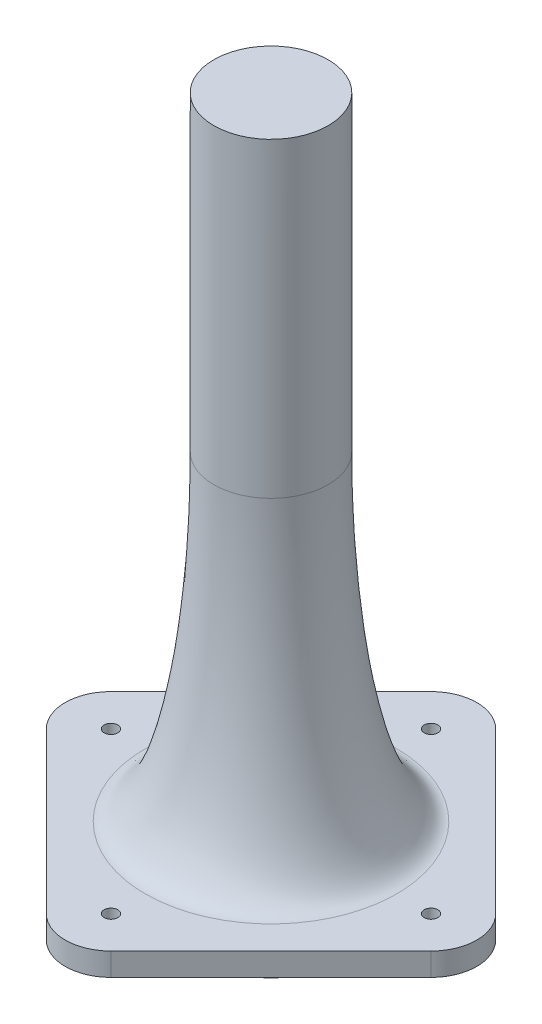
from build123d import *

# Parameters (mm, degrees)
CROQUIS1_R              = 12.5
SALIENTE_EXTRUIR1_DEPTH = 150
CROQUIS2_R              = 25
SALIENTE_EXTRUIR2_DEPTH = 7
CROQUIS3_R              = 1.5
SALIENTE_EXTRUIR3_DEPTH = 5
REDONDEO1_SIZE          = 15
REDONDEO1_SIZE_2        = 70


with BuildPart() as part:
    # Croquis1 → Saliente-Extruir1 (new body)
    with BuildSketch(Plane(origin=(0, 0, 0), x_dir=(1, 0, 0), z_dir=(0, 1, 0))):
        with Locations(Location((0, 0, 0), (0, 0, 270))):
            Circle(CROQUIS1_R)
    extrude(amount=SALIENTE_EXTRUIR1_DEPTH)

    # Croquis2 → Saliente-Extruir2 (add)
    with BuildSketch(Plane.XZ):
        with Locations(Location((0, 0, 0), (0, 0, 270))):
            Circle(CROQUIS2_R)
    extrude(amount=-SALIENTE_EXTRUIR2_DEPTH)

    # Croquis3 → Saliente-Extruir3 (add)
    with BuildSketch(Plane(origin=(0, 7, 0), x_dir=(1, 0, 0), z_dir=(0, 1, 0))):
        with BuildLine():
            Line((-7.071067812, 42.071067812), (-42.071067812, 7.071067812))
            ThreePointArc((-42.071067812, 7.071067812), (-45, 0), (-42.071067812, -7.071067812))
            Line((-42.071067812, -7.071067812), (-7.071067812, -42.071067812))
            ThreePointArc((-7.071067812, -42.071067812), (0, -45), (7.071067812, -42.071067812))
            Line((7.071067812, -42.071067812), (42.071067812, -7.071067812))
            ThreePointArc((42.071067812, -7.071067812), (45, 0), (42.071067812, 7.071067812))
            Line((42.071067812, 7.071067812), (7.071067812, 42.071067812))
            ThreePointArc((7.071067812, 42.071067812), (0, 45), (-7.071067812, 42.071067812))
        make_face()
        with Locations(Location((-35, 0, 0), (0, 0, 270))):
            Circle(CROQUIS3_R, mode=Mode.SUBTRACT)
        with Locations(Location((0, 35, 0), (0, 0, 270))):
            Circle(CROQUIS3_R, mode=Mode.SUBTRACT)
        with Locations(Location((35, 0, 0), (0, 0, 270))):
            Circle(CROQUIS3_R, mode=Mode.SUBTRACT)
        with Locations(Location((0, -35, 0), (0, 0, 270))):
            Circle(CROQUIS3_R, mode=Mode.SUBTRACT)
    extrude(amount=SALIENTE_EXTRUIR3_DEPTH)

    # Redondeo1
    # an asymmetric fillet: 70, 15 mm, written as the material it adds along each edge
    with BuildSketch(Plane(origin=(0, 12, 0), x_dir=(0, 0, 1), z_dir=(1, 0, 0))) as redondeo1_piece_1:
        with BuildLine():
            Bezier((12.5 + REDONDEO1_SIZE, REDONDEO1_SIZE * 9.99999999998e-06), (12.49985, 0.00015), (12.5 - REDONDEO1_SIZE_2 * 2.14285714285e-06, -REDONDEO1_SIZE_2), weights=[1, 0.707106781, 1])
            Line((12.5 - REDONDEO1_SIZE_2 * 2.14285714285e-06, -REDONDEO1_SIZE_2), (11.09985, -70))
            ThreePointArc((11.09985, -70), (11.1, -35), (11.1, 0))
            Line((11.1, 0), (12.5, 1.4))
            ThreePointArc((12.5, 1.4), (20, 1.4), (27.5, 1.40015))
            Line((27.5, 1.40015), (12.5 + REDONDEO1_SIZE, REDONDEO1_SIZE * 9.99999999998e-06))
        make_face()
    revolve(axis=Axis((0, 12, 0), (0, -1, 0)))


solid = part.part
